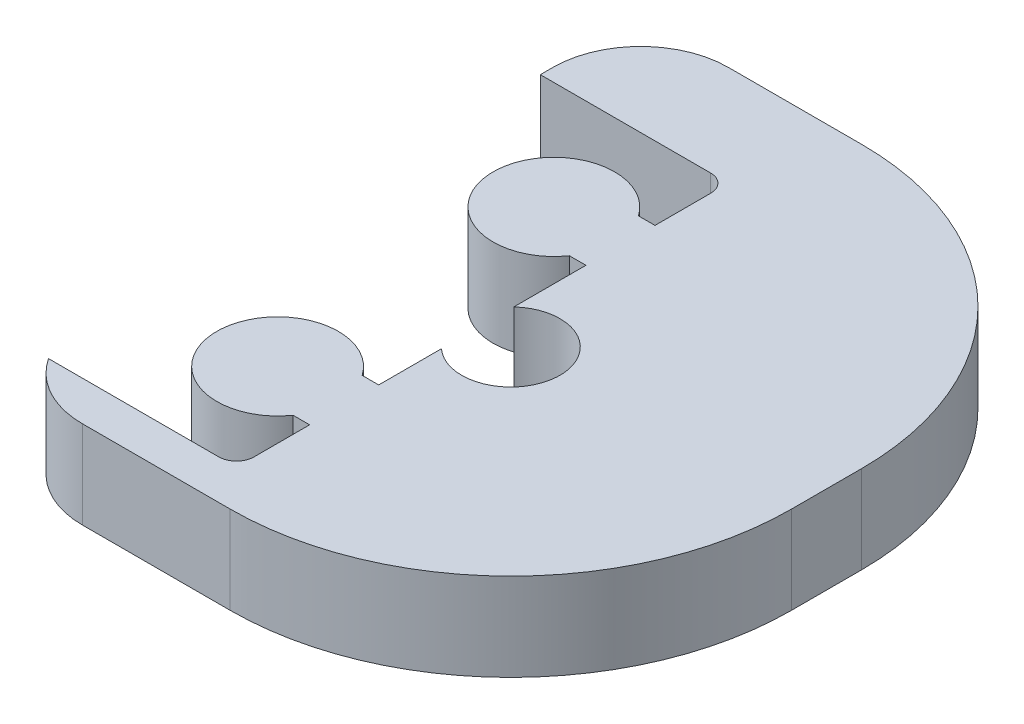
from build123d import *

# Parameters (mm, degrees)
SKETCH1_W           = 50.8
SKETCH1_H           = 22.86
BOSS_EXTRUDE1_DEPTH = 3.175
FILLET1_R           = 10.16
SKETCH3_R           = 1.778
CUT_EXTRUDE1_DEPTH  = 29.033649869
FILLET3_R           = 10.16
CUT_EXTRUDE3_DEPTH  = 29.033649869
FILLET4_R           = 0.635
FILLET5_R           = 3.175


with BuildPart() as part:
    # Sketch1 → Boss-Extrude1 (new body)
    with BuildSketch(Plane(origin=(0, 0, 0), x_dir=(1, 0, 0), z_dir=(0, 1, 0))):
        Rectangle(SKETCH1_W, SKETCH1_H)
    extrude(amount=BOSS_EXTRUDE1_DEPTH)

    # Fillet1
    fillet1_edges = [part.edges().sort_by_distance(p)[0] for p in [
        (25.4, 1.5875, 11.43),
        (-25.4, 1.5875, 11.43),
    ]]
    fillet(fillet1_edges, radius=FILLET1_R)

    # Sketch3 → Cut-Extrude1 (cut, through all)
    with BuildSketch(Plane(origin=(0, 3.175, 0), x_dir=(1, 0, 0), z_dir=(0, 1, 0))):
        with Locations(Location((15.24, -1.27, 0), (0, 0, 270))):
            Circle(SKETCH3_R)
        with Locations(Location((-3.81, -1.27, 0), (0, 0, 270))):
            Circle(SKETCH3_R)
    extrude(amount=-CUT_EXTRUDE1_DEPTH, mode=Mode.SUBTRACT)

    # Fillet3
    fillet3_edges = [part.edges().sort_by_distance(p)[0] for p in [
        (-25.4, 1.5875, -11.43),
        (25.4, 1.5875, -11.43),
    ]]
    fillet(fillet3_edges, radius=FILLET3_R)

    # Sketch5 → Cut-Extrude3 (cut, through all)
    with BuildSketch(Plane.XZ):
        with BuildLine():
            Line((7.239, -11.43), (7.239, -7.799110591))
            Line((7.239, -7.799110591), (14.039031064, -7.799110591))
            Line((14.039031064, -7.799110591), (14.039031064, -5.149110591))
            Line((14.039031064, -5.149110591), (13.439031064, -5.149110591))
            ThreePointArc((13.439031064, -5.149110591), (9.428644365, -3.899110591), (13.439031064, -2.649110591))
            Line((13.439031064, -2.649110591), (14.039031064, -2.649110591))
            Line((14.039031064, -2.649110591), (14.039031064, 4.850889409))
            Line((14.039031064, 4.850889409), (13.439031064, 4.850889409))
            ThreePointArc((13.439031064, 4.850889409), (9.428644366, 6.100889409), (13.439031064, 7.350889409))
            Line((13.439031064, 7.350889409), (14.039031064, 7.350889409))
            Line((14.039031064, 7.350889409), (14.039031064, 10.000889409))
            Line((14.039031064, 10.000889409), (7.239, 10.000889409))
            Line((7.239, 10.000889409), (7.239, 11.43))
            Line((7.239, 11.43), (-25.4, 11.43))
            Line((-25.4, 11.43), (-25.4, -11.43))
            Line((-25.4, -11.43), (7.239, -11.43))
        make_face()
    extrude(amount=-CUT_EXTRUDE3_DEPTH, mode=Mode.SUBTRACT)

    # Fillet4
    fillet4_edges = [part.edges().sort_by_distance(p)[0] for p in [
        (14.039031064, 1.5875, 10.000889409),
        (14.039031064, 1.5875, -7.799110591),
    ]]
    fillet(fillet4_edges, radius=FILLET4_R)

    # Fillet5
    # the kernel refuses this fillet: 3.175 mm, written as the material it takes off along each edge
    with BuildSketch(Plane(origin=(7.239, -7.9375, -11.43), x_dir=(1, 0, 0), z_dir=(0, 1, 0))) as fillet5_piece_1:
        with BuildLine():
            CenterArc((FILLET5_R, -FILLET5_R), FILLET5_R, 90, 90)
            Line((0, -FILLET5_R), (-FILLET5_R * 0.02, -FILLET5_R))
            Line((-FILLET5_R * 0.02, -FILLET5_R), (-FILLET5_R * 0.02, FILLET5_R * 0.02))
            Line((-FILLET5_R * 0.02, FILLET5_R * 0.02), (FILLET5_R, FILLET5_R * 0.02))
            Line((FILLET5_R, FILLET5_R * 0.02), (FILLET5_R, 0))
        make_face()
    extrude(amount=19.05, mode=Mode.SUBTRACT)
    with BuildSketch(Plane(origin=(7.239, -6.629713028, 11.43), x_dir=(1.52265132002689e-12, 0, -1.0), z_dir=(0, 1, 0))) as fillet5_piece_2:
        with BuildLine():
            CenterArc((3.175, -2.651885211), FILLET5_R, 123.359221801, 56.640778199)
            Line((0, -2.651885211), (-0.0635, -2.651885211))
            Line((-0.0635, -2.651885211), (-0.0635, 0))
            Line((-0.0635, 0), (0, 0.0635))
            ThreePointArc((0, 0.0635), (0.714555296, 0.0635), (1.394192803, 0.053037704))
            Line((1.394192803, 0.053037704), (1.429110591, 0))
        make_face()
    extrude(amount=16.434426055, mode=Mode.SUBTRACT)


solid = part.part
